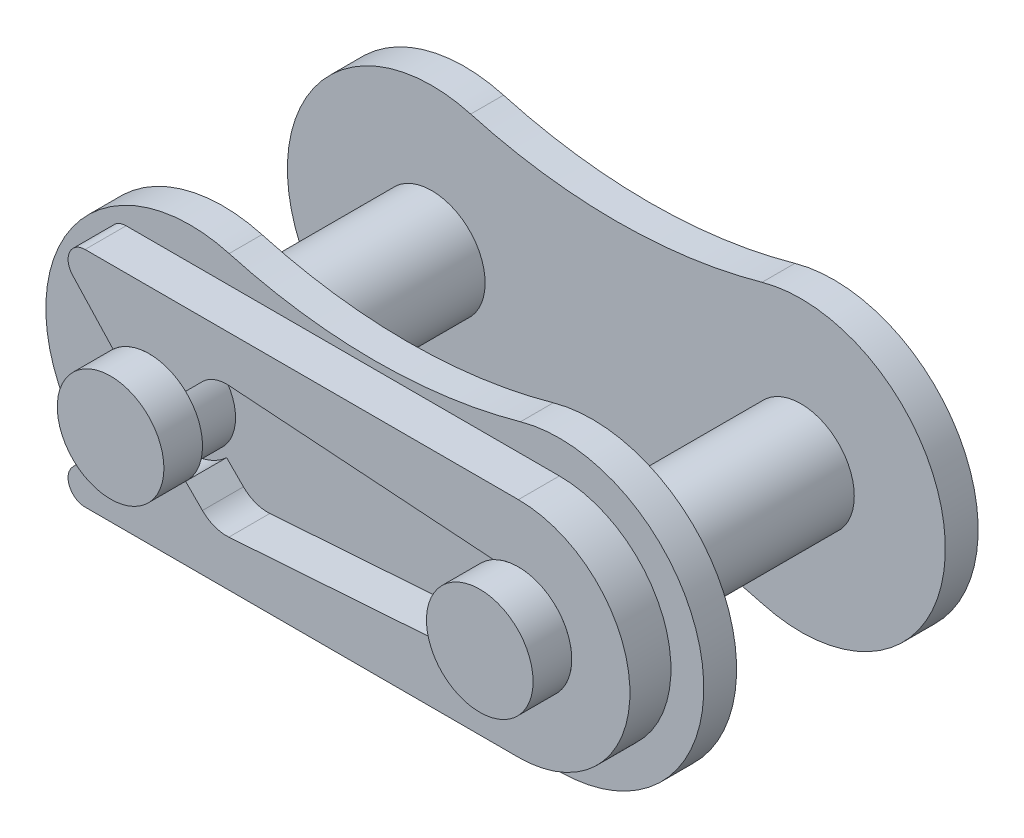
from build123d import *

# Parameters (mm, degrees)
SKETCH4_R                  = 2.5
SKETCH4_R_2                = 1.1811
BOSS_EXTRUDE1_DEPTH        = 1.5
SKETCH5_R                  = 1.1557
BOSS_EXTRUDE2_DEPTH        = 0.7112
LPATTERN1_COUNT            = 2
LPATTERN1_PITCH            = 8.001
SKETCH7_R                  = 1.1557
BOSS_EXTRUDE3_DEPTH        = 0.7112
MIRROR1_START              = 2.262
MIRROR1_OUTLINE_R          = 1.1557
MIRROR1_DEPTH              = 0.7112
BOSS_EXTRUDE4_DEPTH        = 4.699
BOSS_EXTRUDE4_DEPTH_BACK   = 3.81
SKETCH8_R                  = 1.1557
BOSS_EXTRUDE4_2_DEPTH      = 4.699
BOSS_EXTRUDE4_2_DEPTH_BACK = 3.81
BOSS_EXTRUDE5_DEPTH        = 0.889
SKETCH12_R                 = 1.1557
SKETCH12_R_2               = 0.982345
CUT_EXTRUDE1_DEPTH         = 0.889


# Read off the part's stored shape, not the designer's step: Mirror1
with BuildPart() as part:
    # Sketch4 → Boss-Extrude1 (new, symmetric)
    with BuildSketch(Plane.XY):
        with Locations((4.0005, 0)):
            Circle(SKETCH4_R)
        with Locations((4.0005, 0)):
            Circle(SKETCH4_R_2, mode=Mode.SUBTRACT)
    extrude(amount=BOSS_EXTRUDE1_DEPTH, both=True)


with BuildPart() as body_2:
    # Sketch5 → Boss-Extrude2 (new body)
    with BuildSketch(Plane.XY.offset(1.5)):
        with BuildLine():
            ThreePointArc((-3.068796943, 3.431772926), (-7.5565, 0), (-3.068796943, -3.431772926))
            ThreePointArc((-3.068796943, -3.431772926), (0, -3.0226), (3.068796943, -3.431772926))
            ThreePointArc((3.068796943, -3.431772926), (7.5565, 0), (3.068796943, 3.431772926))
            ThreePointArc((3.068796943, 3.431772926), (0, 3.0226), (-3.068796943, 3.431772926))
        make_face()
        with Locations((-4.0005, 0)):
            Circle(SKETCH5_R, mode=Mode.SUBTRACT)
        with Locations((4.0005, 0)):
            Circle(SKETCH5_R, mode=Mode.SUBTRACT)
    extrude(amount=BOSS_EXTRUDE2_DEPTH)


with BuildPart() as lpattern1_1:
    # LPattern1: pattern copy
    add(part.part.moved(Location(Vector(1, 0, 0) * (1 * LPATTERN1_PITCH))))


with BuildPart() as body_4:
    # Sketch7 → Boss-Extrude3 (new body)
    with BuildSketch(Plane.XY.offset(-2.262)):
        with BuildLine():
            ThreePointArc((4.843971698, 3.013461268), (0.87122, 0), (4.843971698, -3.013461268))
            ThreePointArc((4.843971698, -3.013461268), (8.001, -2.579963599), (11.158028302, -3.013461268))
            ThreePointArc((11.158028302, -3.013461268), (15.13078, 0), (11.158028302, 3.013461268))
            ThreePointArc((11.158028302, 3.013461268), (8.001, 2.579963599), (4.843971698, 3.013461268))
        make_face()
        with Locations((4.0005, 0)):
            Circle(SKETCH7_R, mode=Mode.SUBTRACT)
        with Locations((12.0015, 0)):
            Circle(SKETCH7_R, mode=Mode.SUBTRACT)
    extrude(amount=-BOSS_EXTRUDE3_DEPTH)


with BuildPart() as body_5:
    # Mirror1 outline → Mirror1 (new body)
    with BuildSketch(Plane.XY.offset(MIRROR1_START)):
        with BuildLine():
            ThreePointArc((11.158028302, -3.013461268), (15.13078, 0), (11.158028302, 3.013461268))
            ThreePointArc((11.158028302, 3.013461268), (8.001, 2.579963599), (4.843971698, 3.013461268))
            ThreePointArc((4.843971698, 3.013461268), (0.87122, 0), (4.843971698, -3.013461268))
            ThreePointArc((4.843971698, -3.013461268), (8.001, -2.579963599), (11.158028302, -3.013461268))
        make_face()
        with Locations((4.0005, 0)):
            Circle(MIRROR1_OUTLINE_R, mode=Mode.SUBTRACT)
        with Locations((12.0015, 0)):
            Circle(MIRROR1_OUTLINE_R, mode=Mode.SUBTRACT)
    extrude(amount=MIRROR1_DEPTH)


with BuildPart() as body_3:
    # Sketch8 → Boss-Extrude4 (new, two sides: drawn at the far end of the back side and taken through both)
    with BuildSketch(Plane.XY.offset(-BOSS_EXTRUDE4_DEPTH_BACK)):
        with Locations((4.0005, 0)):
            Circle(SKETCH8_R)
    extrude(amount=BOSS_EXTRUDE4_DEPTH + BOSS_EXTRUDE4_DEPTH_BACK)


with BuildPart() as body_4_2:
    # Sketch8 → Boss-Extrude4 2 (new, two sides: drawn at the far end of the back side and taken through both)
    with BuildSketch(Plane.XY.offset(-BOSS_EXTRUDE4_2_DEPTH_BACK)):
        with Locations((12.0015, 0)):
            Circle(SKETCH8_R)
    extrude(amount=BOSS_EXTRUDE4_2_DEPTH + BOSS_EXTRUDE4_2_DEPTH_BACK)


with BuildPart() as body_5_2:
    # Sketch10 → Boss-Extrude5 (new body)
    with BuildSketch(Plane.XY.offset(2.9732)):
        with BuildLine():
            Line((12.0015, -2.41808), (2.610756693, -2.41808))
            ThreePointArc((2.610756693, -2.41808), (2.273325514, -2.197496306), (2.339998478, -1.79991401))
            Line((2.339998478, -1.79991401), (3.33440236, -0.722021906))
            ThreePointArc((3.33440236, -0.722021906), (4.0005, -0.982345), (4.66659764, -0.722021906))
            Line((4.66659764, -0.722021906), (5.154115021, -1.209539288))
            ThreePointArc((5.154115021, -1.209539288), (5.417063777, -1.378673611), (5.726475822, -1.423536222))
            Line((5.726475822, -1.423536222), (12.070024923, -0.979952057))
            ThreePointArc((12.070024923, -0.979952057), (12.983845, 0), (12.070024923, 0.979952057))
            Line((12.070024923, 0.979952057), (5.726475822, 1.423536222))
            ThreePointArc((5.726475822, 1.423536222), (5.417063777, 1.378673611), (5.154115021, 1.209539288))
            Line((5.154115021, 1.209539288), (4.66659764, 0.722021906))
            ThreePointArc((4.66659764, 0.722021906), (4.0005, 0.982345), (3.33440236, 0.722021906))
            Line((3.33440236, 0.722021906), (2.339998478, 1.79991401))
            ThreePointArc((2.339998478, 1.79991401), (2.273325514, 2.197496306), (2.610756693, 2.41808))
            Line((2.610756693, 2.41808), (12.0015, 2.41808))
            ThreePointArc((12.0015, 2.41808), (14.41958, 0), (12.0015, -2.41808))
        make_face()
    extrude(amount=BOSS_EXTRUDE5_DEPTH)


with BuildPart() as cut_extrude1_tool:
    # Sketch12 → Cut-Extrude1 (new body)
    # profile 1 of 2: a face of its own
    with BuildSketch(Plane.XY.offset(2.9732)):
        with Locations((4.0005, 0)):
            Circle(SKETCH12_R)
        with Locations((4.0005, 0)):
            Circle(SKETCH12_R_2, mode=Mode.SUBTRACT)
    # profile 2 of 2: a face of its own
    with BuildSketch(Plane.XY.offset(2.9732)):
        with Locations((12.0015, 0)):
            Circle(SKETCH12_R)
        with Locations((12.0015, 0)):
            Circle(SKETCH12_R_2, mode=Mode.SUBTRACT)
    extrude(amount=CUT_EXTRUDE1_DEPTH)


with BuildPart() as body_3_1:
    add(body_3.part)

    # Cut-Extrude1: cut by cut_extrude1_tool
    add(cut_extrude1_tool.part, mode=Mode.SUBTRACT)


with BuildPart() as body_4_2_1:
    add(body_4_2.part)

    # Cut-Extrude1: cut by cut_extrude1_tool
    add(cut_extrude1_tool.part, mode=Mode.SUBTRACT)


with BuildPart() as body_5_2_1:
    add(body_5_2.part)

    # Cut-Extrude1: cut by cut_extrude1_tool
    add(cut_extrude1_tool.part, mode=Mode.SUBTRACT)


with BuildPart() as body_4_1:
    add(body_4.part)

    # Combine3: union body 5, body 4 2, body 3
    add(body_5.part)
    add(body_4_2_1.part)
    add(body_3_1.part)


solid = Compound([body_5_2_1.part, body_4_1.part])
